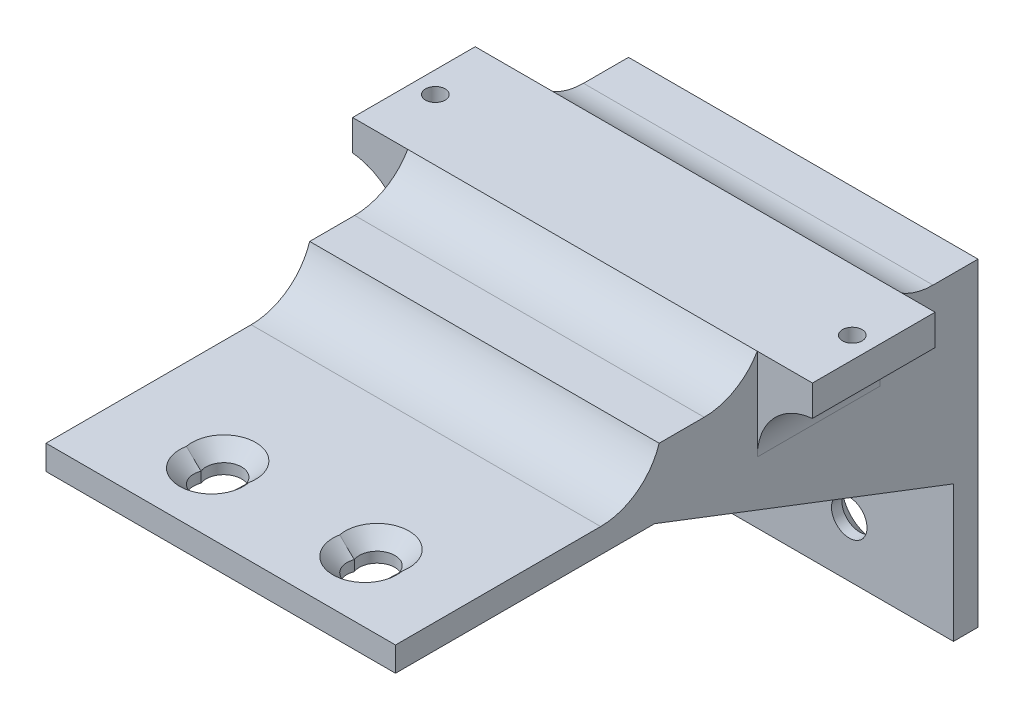
from build123d import *
from build123d.topology import SkipClean

# Parameters (mm, degrees)
SALIENTE_EXTRUIR1_DEPTH                              = 57
CROQUIS2_R                                           = 2.5
CORTAR_EXTRUIR1_DEPTH                                = 55
CORTAR_EXTRUIR2_DEPTH                                = 55
AVELLANADO_PARA_TORNILLO_CON_CABEZA_PLAN_D           = 5.8
AVELLANADO_PARA_TORNILLO_CON_CABEZA_PLAN_CSINK_D     = 10.4
AVELLANADO_PARA_TORNILLO_CON_CABEZA_PLAN_CSINK_ANGLE = 90
SALIENTE_EXTRUIR2_DEPTH                              = 57
CROQUIS12_W                                          = 75
CROQUIS12_H                                          = 20
SALIENTE_EXTRUIR3_DEPTH                              = 5
CROQUIS14_R                                          = 1.6
CORTAR_EXTRUIR3_DEPTH                                = 5
REDONDEO1_R                                          = 10
REDONDEO2_R                                          = 10
REDONDEO3_R                                          = 10
REDONDEO4_START                                      = -76
REDONDEO4_DEPTH                                      = 8.3999999
REDONDEO4_START_2                                    = -64.399999871
REDONDEO4_2_DEPTH                                    = 8.399999871
REDONDEO4_START_3                                    = -67.6000001
REDONDEO4_3_DEPTH                                    = 3.200000229
REDONDEO4_START_4                                    = -2.949874371
REDONDEO4_4_OUTLINE_R                                = 1.6
REDONDEO4_4_DEPTH                                    = 9.949874371
REDONDEO6_START                                      = -64.3999999
REDONDEO6_DEPTH                                      = 8.3999999
REDONDEO6_START_2                                    = -76
REDONDEO6_2_DEPTH                                    = 8.399997691
REDONDEO6_START_3                                    = -67.600002309
REDONDEO6_3_DEPTH                                    = 3.200002409
REDONDEO6_START_4                                    = -2.949874371
REDONDEO6_4_OUTLINE_R                                = 1.6
REDONDEO6_4_DEPTH                                    = 9.949874371
CORTAR_BARRER2_PROFILE_R                             = 5
AVELLANADO_PARA_TORNILLO_CON_CABEZA_2_D              = 5.8
AVELLANADO_PARA_TORNILLO_CON_CABEZA_2_CSINK_D        = 10.4
AVELLANADO_PARA_TORNILLO_CON_CABEZA_2_CSINK_ANGLE    = 90


with BuildPart() as part:
    # Croquis1 → Saliente-Extruir1 (new body)
    with BuildSketch(Plane(origin=(0, 0, 0), x_dir=(0, 0, -1), z_dir=(1, 0, 0))):
        Polygon((0, 0), (40, 0), (92, -20), (92, -45), (88, -45), (88, -22.747196393), (39.257289378, -4), (0, -4), (-3, -4), (-3, 0), align=None)
    extrude(amount=SALIENTE_EXTRUIR1_DEPTH)

    # Croquis2 → Cortar-Extruir1 (cut)
    with BuildSketch(Plane(origin=(0, 0, -92), x_dir=(-1, 0, 0), z_dir=(0, 0, -1))):
        with Locations(Location((-40, -36, 0), (0, 0, 90))):
            Circle(CROQUIS2_R)
        with Locations(Location((-15, -36, 0), (0, 0, 90))):
            Circle(CROQUIS2_R)
    extrude(amount=-CORTAR_EXTRUIR1_DEPTH, mode=Mode.SUBTRACT)

    # Croquis3 → Cortar-Extruir2 (cut)
    with BuildSketch(Plane(origin=(0, 0, 0), x_dir=(1, 0, 0), z_dir=(0, 1, 0))):
        with BuildLine():
            ThreePointArc((19.291287847, 8), (17, 11.5), (14.708712153, 8))
            ThreePointArc((14.708712153, 8), (17, 4.5), (19.291287847, 8))
        make_face()
        with BuildLine():
            ThreePointArc((44.291287847, 8), (42, 11.5), (39.708712153, 8))
            ThreePointArc((39.708712153, 8), (42, 4.5), (44.291287847, 8))
        make_face()
    extrude(amount=-CORTAR_EXTRUIR2_DEPTH, mode=Mode.SUBTRACT)

    # Avellanado para tornillo con cabeza plan (through all)
    with Locations(Plane(origin=(0, 0, -92), x_dir=(-1, 0, 0), z_dir=(0, 0, -1))):
        with Locations((-15, -36), (-40, -36)):
            CounterSinkHole(AVELLANADO_PARA_TORNILLO_CON_CABEZA_PLAN_D / 2, AVELLANADO_PARA_TORNILLO_CON_CABEZA_PLAN_CSINK_D / 2, counter_sink_angle=AVELLANADO_PARA_TORNILLO_CON_CABEZA_PLAN_CSINK_ANGLE)

    # Croquis10 → Saliente-Extruir2 (add)
    with BuildSketch(Plane.ZY):
        Polygon((-92, -20), (-92, 7), (-40, 7), (-40, 0), align=None)
    extrude(amount=-SALIENTE_EXTRUIR2_DEPTH)

    # Croquis12 → Saliente-Extruir3 (add)
    with BuildSketch(Plane(origin=(0, 7, 0), x_dir=(1, 0, 0), z_dir=(0, 1, 0))):
        with Locations((28.5, 66)):
            Rectangle(CROQUIS12_W, CROQUIS12_H)
    extrude(amount=SALIENTE_EXTRUIR3_DEPTH)

    # Croquis14 → Cortar-Extruir3 (cut)
    with BuildSketch(Plane(origin=(0, 12, 0), x_dir=(1, 0, 0), z_dir=(0, 1, 0))):
        with Locations(Location((-5.5, 66, 0), (0, 0, 270))):
            Circle(CROQUIS14_R)
        with Locations(Location((62.5, 66, 0), (0, 0, 270))):
            Circle(CROQUIS14_R)
    extrude(amount=-CORTAR_EXTRUIR3_DEPTH, mode=Mode.SUBTRACT)

    # Redondeo1
    # the kernel refuses this fillet: 10 mm, written as the material it adds along each edge
    with BuildSketch(Plane(origin=(57, 7, -76), x_dir=(0, 0, -1), z_dir=(-1, 0, 0))) as redondeo1_piece_1:
        with BuildLine():
            CenterArc((8.660254038, -10), REDONDEO1_R, 90, 60)
            Line((0, -5), (0, 0))
            Line((0, 0), (8.660254038, 0))
        make_face()
    extrude(amount=57)

    # Redondeo2
    # the kernel refuses this fillet: 10 mm, written as the material it adds along each edge
    with BuildSketch(Plane(origin=(0, 7, -56), x_dir=(0, 1, 0), z_dir=(1, 0, 0))) as redondeo2_piece_1:
        with BuildLine():
            CenterArc((10, 8.660254038), REDONDEO2_R, 180, 60)
            Line((0, 8.660254038), (0, 0))
            Line((0, 0), (5, 0))
        make_face()
    extrude(amount=57)

    # Redondeo3
    # the kernel refuses this fillet: 10 mm, written as the material it adds along each edge
    with BuildSketch(Plane(origin=(0, 0, -40), x_dir=(0, 1, 0), z_dir=(1, 0, 0))) as redondeo3_piece_1:
        with BuildLine():
            CenterArc((10, 9.539392014), REDONDEO3_R, 180, 72.542396876)
            Line((0, 9.539392014), (-0.2, 9.539392014))
            Line((-0.2, 9.539392014), (-0.2, 0))
            Line((-0.2, 0), (0, -0.2))
            ThreePointArc((0, -0.2), (3.5, -0.2), (6.94, -0.19078784))
            Line((6.94, -0.19078784), (7, 0))
        make_face()
    extrude(amount=57)

    # Redondeo4: read off the stored shape, not the designer's step
    # Redondeo4 outline → Redondeo4 (add)
    with BuildSketch(Plane.XY.offset(REDONDEO4_START)):
        with BuildLine():
            ThreePointArc((-9, 7), (-2.583801513, 3.758329561), (0, -2.949874371))
            Line((0, -2.949874371), (0, 7))
            Line((0, 7), (-9, 7))
        make_face()
    extrude(amount=REDONDEO4_DEPTH)

    # Redondeo4 2 outline → Redondeo4 2 (add)
    with BuildSketch(Plane.XY.offset(REDONDEO4_START_2)):
        with BuildLine():
            ThreePointArc((-9, 7), (-2.583801513, 3.758329561), (0, -2.949874371))
            Line((0, -2.949874371), (0, 7))
            Line((0, 7), (-9, 7))
        make_face()
    extrude(amount=REDONDEO4_2_DEPTH)

    # Redondeo4 3 outline → Redondeo4 3 (add)
    with BuildSketch(Plane.XY.offset(REDONDEO4_START_3)):
        with BuildLine():
            ThreePointArc((-9, 7), (-2.583801513, 3.758329561), (0, -2.949874371))
            Line((0, -2.949874371), (0, 7))
            Line((0, 7), (-9, 7))
        make_face()
    extrude(amount=REDONDEO4_3_DEPTH)

    # Redondeo4 4 outline → Redondeo4 4 (cut)
    with SkipClean():  # the faces are left unmerged after this step: merging them gives an invalid solid
        with BuildSketch(Plane(origin=(0, 0, 0), x_dir=(1, 0, 0), z_dir=(0, 1, 0)).offset(REDONDEO4_START_4)):
            with Locations((-5.5, 66)):
                Circle(REDONDEO4_4_OUTLINE_R)
        extrude(amount=REDONDEO4_4_DEPTH, mode=Mode.SUBTRACT)

    # Redondeo6: read off the stored shape, not the designer's step
    # Redondeo6 outline → Redondeo6 (add)
    with SkipClean():  # the faces are left unmerged after this step: merging them gives an invalid solid
        with BuildSketch(Plane.XY.offset(REDONDEO6_START)):
            with BuildLine():
                Line((57, 7), (57, -2.949874371))
                ThreePointArc((57, -2.949874371), (59.583801513, 3.758329561), (66, 7))
                Line((66, 7), (57, 7))
            make_face()
        extrude(amount=REDONDEO6_DEPTH)

    # Redondeo6 2 outline → Redondeo6 2 (add)
    with SkipClean():  # the faces are left unmerged after this step: merging them gives an invalid solid
        with BuildSketch(Plane.XY.offset(REDONDEO6_START_2)):
            with BuildLine():
                Line((57, 7), (57, -2.949874371))
                ThreePointArc((57, -2.949874371), (59.583801513, 3.758329561), (66, 7))
                Line((66, 7), (57, 7))
            make_face()
        extrude(amount=REDONDEO6_2_DEPTH)

    # Redondeo6 3 outline → Redondeo6 3 (add)
    with SkipClean():  # the faces are left unmerged after this step: merging them gives an invalid solid
        with BuildSketch(Plane.XY.offset(REDONDEO6_START_3)):
            with BuildLine():
                Line((57, 7), (57, -2.949874371))
                ThreePointArc((57, -2.949874371), (59.583801513, 3.758329561), (66, 7))
                Line((66, 7), (57, 7))
            make_face()
        extrude(amount=REDONDEO6_3_DEPTH)

    # Redondeo6 4 outline → Redondeo6 4 (cut)
    with SkipClean():  # the faces are left unmerged after this step: merging them gives an invalid solid
        with BuildSketch(Plane(origin=(0, 0, 0), x_dir=(1, 0, 0), z_dir=(0, 1, 0)).offset(REDONDEO6_START_4)):
            with Locations((62.5, 66)):
                Circle(REDONDEO6_4_OUTLINE_R)
        extrude(amount=REDONDEO6_4_DEPTH, mode=Mode.SUBTRACT)

    # Cortar-Barrer2: sweep along a path in Croquis19
    with SkipClean():  # the faces are left unmerged after this step: merging them gives an invalid solid
        with BuildLine(Plane.ZY.offset(-30)) as cortar_barrer2_path:
            ThreePointArc((-75.745624834, -21.022790663), (-83.359510297, -7.744837318), (-96.561509835, 0))
        # Cortar-Barrer2 profile (on start of the path) → Cortar-Barrer2 (sweep, cut)
        with BuildSketch(Plane(origin=(30, -21.022790663, -75.745624834), x_dir=(0, 0.25789602610646195, 0.9661726759324625), z_dir=(0, 0.9661726759324625, -0.25789602610646195))):
            Circle(CORTAR_BARRER2_PROFILE_R)
        sweep(path=cortar_barrer2_path.line, mode=Mode.SUBTRACT)

    # Avellanado para tornillo con cabeza  2 (through all)
    with Locations(Plane(origin=(17, 0, -9), x_dir=(0, 0, 1), z_dir=(0, 1, 0))):
        with Locations((0, 0), (2, 0), (0, 25), (2, 25)):
            CounterSinkHole(AVELLANADO_PARA_TORNILLO_CON_CABEZA_2_D / 2, AVELLANADO_PARA_TORNILLO_CON_CABEZA_2_CSINK_D / 2, counter_sink_angle=AVELLANADO_PARA_TORNILLO_CON_CABEZA_2_CSINK_ANGLE)


solid = part.part
